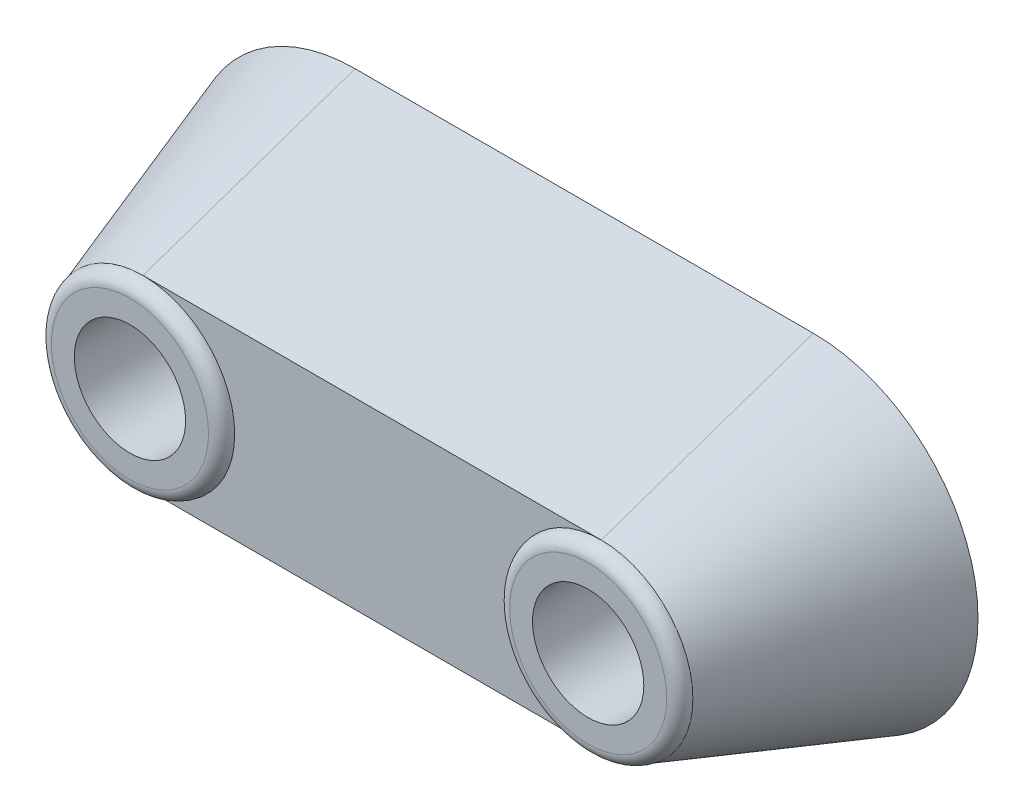
from build123d import *
from build123d.topology import SkipClean

# Parameters (mm, degrees)
SKETCH1_R           = 4.25
SKETCH1_W           = 20
SKETCH1_H           = 5
BOSS_EXTRUDE1_DEPTH = 3
SKETCH2_R           = 7
SKETCH2_R_2         = 4.25
BOSS_EXTRUDE2_DEPTH = 1
FILLET1_R           = 1
CUT_EXTRUDE1_DEPTH  = 48.11952886
BOSS_EXTRUDE3_DEPTH = 16.2
BOSS_EXTRUDE3_DRAFT = 19
SKETCH5_R           = 4.25
CUT_EXTRUDE2_DEPTH  = 58.252151387


with BuildPart() as part:
    # Sketch1 → Boss-Extrude1 (new body)
    with BuildSketch(Plane.XY):
        with BuildLine():
            Line((9, -33.5), (-26, -33.5))
            ThreePointArc((-26, -33.5), (-33, -26.5), (-26, -19.5))
            Line((-26, -19.5), (-20, -19.5))
            ThreePointArc((-20, -19.5), (-16.464466094, -18.035533906), (-15, -14.5))
            Line((-15, -14.5), (-15, 28.5))
            ThreePointArc((-15, 28.5), (-13.535533906, 32.035533906), (-10, 33.5))
            Line((-10, 33.5), (10, 33.5))
            ThreePointArc((10, 33.5), (13.535533906, 32.035533906), (15, 28.5))
            Line((15, 28.5), (15, -22.894448725))
            ThreePointArc((15, -22.894448725), (15.092571663, -29.946820352), (9, -33.5))
        make_face()
        with Locations((9, -26.5)):
            Circle(SKETCH1_R, mode=Mode.SUBTRACT)
        with Locations((-26, -26.5)):
            Circle(SKETCH1_R, mode=Mode.SUBTRACT)
        with Locations((0, 26)):
            Rectangle(SKETCH1_W, SKETCH1_H, mode=Mode.SUBTRACT)
    extrude(amount=BOSS_EXTRUDE1_DEPTH)

    # Sketch2 → Boss-Extrude2 (add)
    # profile 1 of 2: a face of its own
    with BuildSketch(Plane.XY.offset(3)):
        with Locations(Location((-26, -26.5, 0), (0, 0, 270))):
            Circle(SKETCH2_R)
        with Locations((-26, -26.5)):
            Circle(SKETCH2_R_2, mode=Mode.SUBTRACT)
    # profile 2 of 2: a face of its own
    with BuildSketch(Plane.XY.offset(3)):
        with Locations(Location((9, -26.5, 0), (0, 0, 270))):
            Circle(SKETCH2_R)
        with Locations((9, -26.5)):
            Circle(SKETCH2_R_2, mode=Mode.SUBTRACT)
    extrude(amount=BOSS_EXTRUDE2_DEPTH)

    # Fillet1
    fillet1_edges = [part.edges().sort_by_distance(p)[0] for p in [
        (-26, -19.5, 4),
        (9, -19.5, 4),
    ]]
    fillet(fillet1_edges, radius=FILLET1_R - 0.0001)  # a hair under: the kernel refuses the full size

    # Sketch3 → Cut-Extrude1 (cut, through all)
    with SkipClean():  # the faces are left unmerged after this step: merging them gives an invalid solid
        with BuildSketch(Plane.XY.offset(3)):
            with BuildLine():
                Line((-20, -19.5), (9, -19.5))
                ThreePointArc((9, -19.5), (12.446820352, -20.407428337), (15, -22.894448725))
                Line((15, -22.894448725), (15, 33.5))
                Line((15, 33.5), (-20, 33.5))
                Line((-20, 33.5), (-20, -19.5))
            make_face()
        extrude(amount=-CUT_EXTRUDE1_DEPTH, mode=Mode.SUBTRACT)


with BuildPart() as boss_extrude3_tool:
    # Sketch4 → Boss-Extrude3 (with draft: the straight prism first)
    with BuildSketch(Plane.XY.offset(3)):
        with BuildLine():
            ThreePointArc((-26, -19.5), (-33, -26.5), (-26, -33.5))
            Line((-26, -33.5), (9, -33.5))
            ThreePointArc((9, -33.5), (16, -26.5), (9, -19.5))
            Line((9, -19.5), (-26, -19.5))
        make_face()
    extrude(amount=-BOSS_EXTRUDE3_DEPTH)
    # Boss-Extrude3: the draft: its side faces are tilted about the plane it starts from
    boss_extrude3_sides = [boss_extrude3_tool.faces().sort_by_distance(p)[0] for p in [
        (-33, -26.5, -5.1),
        (-8.5, -33.5, -5.1),
        (16, -26.5, -5.1),
        (-8.5, -19.5, -5.1),
    ]]
    draft(boss_extrude3_sides, Plane.XY.offset(3), BOSS_EXTRUDE3_DRAFT)


with BuildPart() as part_1:
    add(part.part)

    # Boss-Extrude3: add boss_extrude3_tool
    add(boss_extrude3_tool.part)

    # Sketch5 → Cut-Extrude2 (cut, through all)
    with BuildSketch(Plane.XY.offset(3)):
        with Locations((-26, -26.5)):
            Circle(SKETCH5_R)
        with Locations((9, -26.5)):
            Circle(SKETCH5_R)
    extrude(amount=-CUT_EXTRUDE2_DEPTH, mode=Mode.SUBTRACT)


solid = part_1.part
